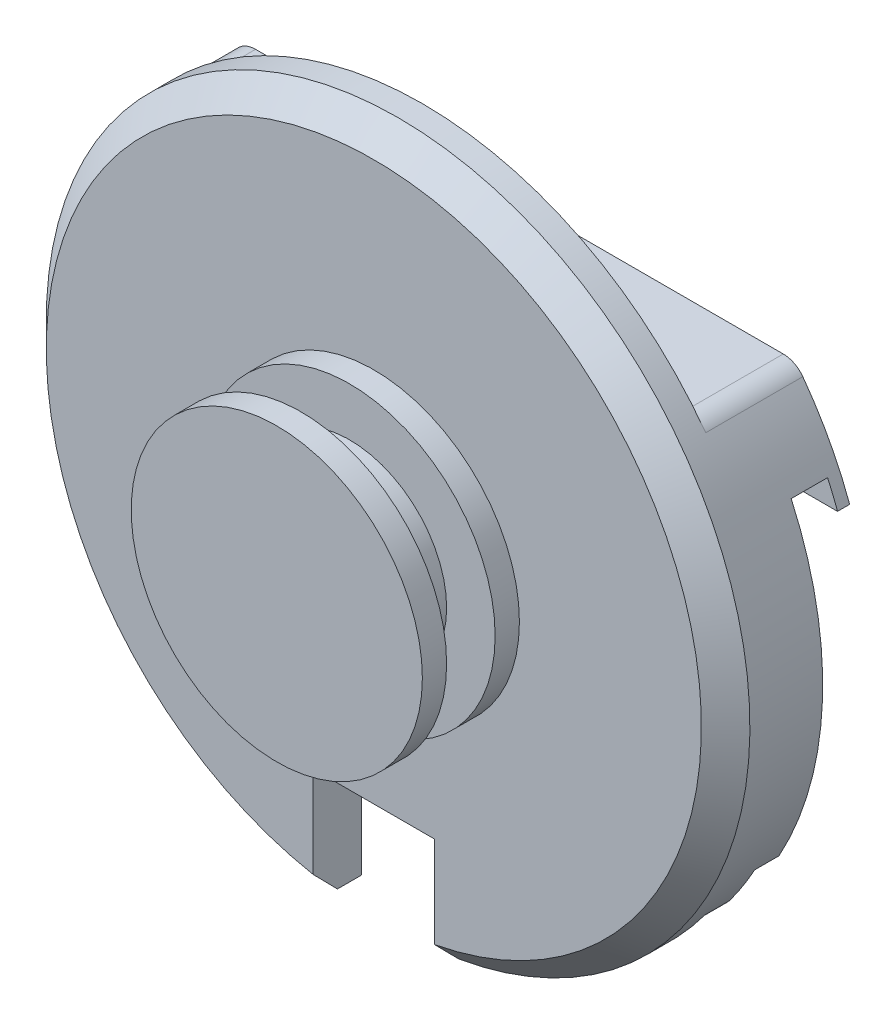
from build123d import *
from build123d.topology import SkipClean

# Parameters (mm, degrees)
SKETCH1_R                       = 14.5
EXTRUDE1_DEPTH                  = 2
CHAMFER1_SIZE                   = 1
SKETCH2_R                       = 6.000000000000001
EXTRUDE2_DEPTH                  = 1
SKETCH3_R                       = 4
EXTRUDE3_DEPTH                  = 2
SKETCH4_R                       = 6.000000000000001
EXTRUDE4_DEPTH                  = 1
EXTRUDE5_START                  = 2
EXTRUDE5_DEPTH                  = 2
SKETCH6_R                       = 2
CUT_EXTRUDE1_DEPTH              = 7
CUT_EXTRUDE1_DRAFT              = -5.000000000000011
EXTRUDE6_REACH                  = 23.366
EXTRUDE6_END_RADIUS             = 14.5
EXTRUDE6_DIRECTION_2_REACH      = 23.366
EXTRUDE6_DIRECTION_2_END_RADIUS = 14.5
EXTRUDE7_DEPTH                  = 6
EXTRUDE8_START                  = 1
EXTRUDE8_DEPTH                  = 1
EXTRUDE_THIN1_DEPTH             = 8
CUT_EXTRUDE3_DEPTH              = 30.449108645254444
FILLET1_R                       = 1


with BuildPart() as part:
    # Sketch1 → Extrude1 (new body)
    with BuildSketch(Plane.XY):
        Circle(SKETCH1_R)
    extrude(amount=EXTRUDE1_DEPTH)

    # Chamfer1
    chamfer1_edges = [part.edges().sort_by_distance(p)[0] for p in [
        (-14.5, 1.78e-15, 2),
    ]]
    chamfer(chamfer1_edges, length=CHAMFER1_SIZE)

    # Sketch2 → Extrude2 (add)
    with BuildSketch(Plane.XY.offset(2)):
        Circle(SKETCH2_R)
    extrude(amount=EXTRUDE2_DEPTH)

    # Sketch3 → Extrude3 (add)
    with BuildSketch(Plane.XY.offset(3)):
        Circle(SKETCH3_R)
    extrude(amount=EXTRUDE3_DEPTH)

    # Sketch4 → Extrude4 (add)
    with BuildSketch(Plane(origin=(0.38976539889290507, -0.9593258286599848, 4.999999999938609), x_dir=(1, 0, 0), z_dir=(0, 0, 1))):
        with Locations((-0.38976539889290507, 0.9593258286599848)):
            Circle(SKETCH4_R)
    extrude(amount=EXTRUDE4_DEPTH)

    # Sketch5 → Extrude5 (add)
    with BuildSketch(Plane(origin=(0, 0, 0), x_dir=(-1, 0, 0), z_dir=(0, 0, -1)).offset(EXTRUDE5_START)):
        with BuildLine():
            Line((-11.368817000902073, 9), (11.368817000902073, 9))
            ThreePointArc((11.368817000902073, 9), (14.450191541160793, 1.2008182309429896), (12.698425099200294, -7))
            Line((12.698425099200294, -7), (-12.698425099200294, -7))
            ThreePointArc((-12.698425099200294, -7), (-14.450191541160793, 1.200818230942998), (-11.368817000902073, 9))
        make_face()
    extrude(amount=-EXTRUDE5_DEPTH)


with BuildPart() as cut_extrude1_tool:
    # Sketch6 → Cut-Extrude1 (with draft: the straight prism first)
    with BuildSketch(Plane(origin=(0, 0, -2), x_dir=(-1, 0, 0), z_dir=(0, 0, -1))):
        Circle(SKETCH6_R)
    extrude(amount=-CUT_EXTRUDE1_DEPTH)
    # Cut-Extrude1: the draft: its side faces are tilted about the plane it starts from
    cut_extrude1_sides = [cut_extrude1_tool.faces().sort_by_distance(p)[0] for p in [
        (2, 0, 1.5),
    ]]
    draft(cut_extrude1_sides, Plane(origin=(0, 0, -2), x_dir=(-1, 0, 0), z_dir=(0, 0, -1)), CUT_EXTRUDE1_DRAFT)


with BuildPart() as part_1:
    add(part.part)

    # Cut-Extrude1: cut by cut_extrude1_tool
    add(cut_extrude1_tool.part, mode=Mode.SUBTRACT)

    # Extrude6: up to this cylinder (the profile starts inside it)
    with SkipClean():  # the faces are left unmerged after this step: merging them gives an invalid solid
        extrude6_end = Plane(origin=(0, 0, -3.0576919999999994), z_dir=(0, 0, -1)) * Cylinder(EXTRUDE6_END_RADIUS, 76.732, mode=Mode.PRIVATE)
        # Sketch7 → Extrude6 (add, up to the surface)
        with BuildSketch(Plane(origin=(0, 0, 0), x_dir=(0, 0, -1), z_dir=(1, 0, 0)), mode=Mode.PRIVATE) as extrude6_sk1:
            Polygon((2, 9), (4, 9.000000000000002), (4, 5.000000000000001), (3.5000000000000004, 5.000000000000001), (3.5000000000000004, 6), (2, 6), align=None)
        extrude6_tool1 = extrude(extrude6_sk1.sketch, amount=EXTRUDE6_REACH, mode=Mode.PRIVATE) & extrude6_end
        add(extrude6_tool1.solids().sort_by_distance((0, 7.346154, -3.057692))[0])

    # Extrude6 direction 2: up to this cylinder (the profile starts inside it)
    with SkipClean():  # the faces are left unmerged after this step: merging them gives an invalid solid
        extrude6_direction_2_end = Plane(origin=(0, 0, -3.0576919999999994), z_dir=(0, 0, -1)) * Cylinder(EXTRUDE6_DIRECTION_2_END_RADIUS, 76.732, mode=Mode.PRIVATE)
        # Sketch7 → Extrude6 direction 2 (add, up to the surface)
        with BuildSketch(Plane(origin=(0, 0, 0), x_dir=(0, 0, -1), z_dir=(1, 0, 0)), mode=Mode.PRIVATE) as extrude6_direction_2_sk1:
            Polygon((2, 9), (4, 9.000000000000002), (4, 5.000000000000001), (3.5000000000000004, 5.000000000000001), (3.5000000000000004, 6), (2, 6), align=None)
        extrude6_direction_2_tool1 = extrude(extrude6_direction_2_sk1.sketch, amount=-EXTRUDE6_DIRECTION_2_REACH, mode=Mode.PRIVATE) & extrude6_direction_2_end
        add(extrude6_direction_2_tool1.solids().sort_by_distance((0, 7.346154, -3.057692))[0])

    # Sketch8 → Extrude7 (add, symmetric)
    with SkipClean():  # the faces are left unmerged after this step: merging them gives an invalid solid
        with BuildSketch(Plane(origin=(0, 2.000000000000001, -5.5e-16), x_dir=(0, 0, -1), z_dir=(-1, 0, 0))):
            Polygon((2, 9), (4, 9.000000000000002), (4, 5.000000000000001), (3.5000000000000004, 5.000000000000001), (3.5000000000000004, 6), (2, 6), align=None)
        extrude(amount=EXTRUDE7_DEPTH, both=True)

    # Sketch9 → Extrude8 (add)
    with SkipClean():  # the faces are left unmerged after this step: merging them gives an invalid solid
        with BuildSketch(Plane(origin=(0, 0, 0), x_dir=(-1, 0, 0), z_dir=(0, 0, -1)).offset(EXTRUDE8_START)):
            with BuildLine():
                Line((-11.368817000902073, -9), (-6.499999999999999, -9))
                Line((-6.499999999999999, -9), (-6.499999999999998, -10))
                Line((-6.499999999999998, -10), (6.5, -9.999999999999998))
                Line((6.5, -9.999999999999998), (6.500000000000001, -8.999999999999998))
                Line((6.500000000000001, -8.999999999999998), (11.368817000902073, -9))
                ThreePointArc((11.368817000902073, -9), (12.075099816408763, -8.027575251828232), (12.698425099200291, -7.000000000000005))
                Line((12.698425099200291, -7.000000000000005), (-12.698425099200294, -7))
                ThreePointArc((-12.698425099200294, -7), (-12.075099816408764, -8.027575251828226), (-11.368817000902073, -9))
            make_face()
        extrude(amount=-EXTRUDE8_DEPTH)

    # Sketch10 → Extrude-Thin1 (add)
    with SkipClean():  # the faces are left unmerged after this step: merging them gives an invalid solid
        with BuildSketch(Plane(origin=(0, 0, -1), x_dir=(-1, 0, 0), z_dir=(0, 0, -1))):
            Polygon((-4.999999999999999, -8.499999999999998), (5.000000000000001, -8.499999999999996), (5.000000000000001, -9.499999999999996), (-4.999999999999999, -9.499999999999998), align=None)
        extrude(amount=EXTRUDE_THIN1_DEPTH)

    # Sketch11 → Cut-Extrude3 (cut, through all)
    with BuildSketch(Plane(origin=(-1.65e-15, -9.499999999999998, 0), x_dir=(-1, 9e-17, 0), z_dir=(9e-17, 1, 0))):
        Polygon((2.4999999999999987, 1.9999999999999978), (-2.4999999999999996, 1.9999999999999973), (-2.4999999999999987, -9.000000000000002), (2.5000000000000013, -9.000000000000002), align=None)
    extrude(amount=-CUT_EXTRUDE3_DEPTH, mode=Mode.SUBTRACT)

    # Fillet1
    fillet1_edges = [part_1.edges().sort_by_distance(p)[0] for p in [
        (11.368817000902073, -9, -0.5),
        (-11.368817000902073, -9, -0.5),
        (-11.368817000902073, 9, -1),
        (11.368817000902073, 9, -1),
    ]]
    fillet(fillet1_edges, radius=FILLET1_R)


solid = part_1.part
